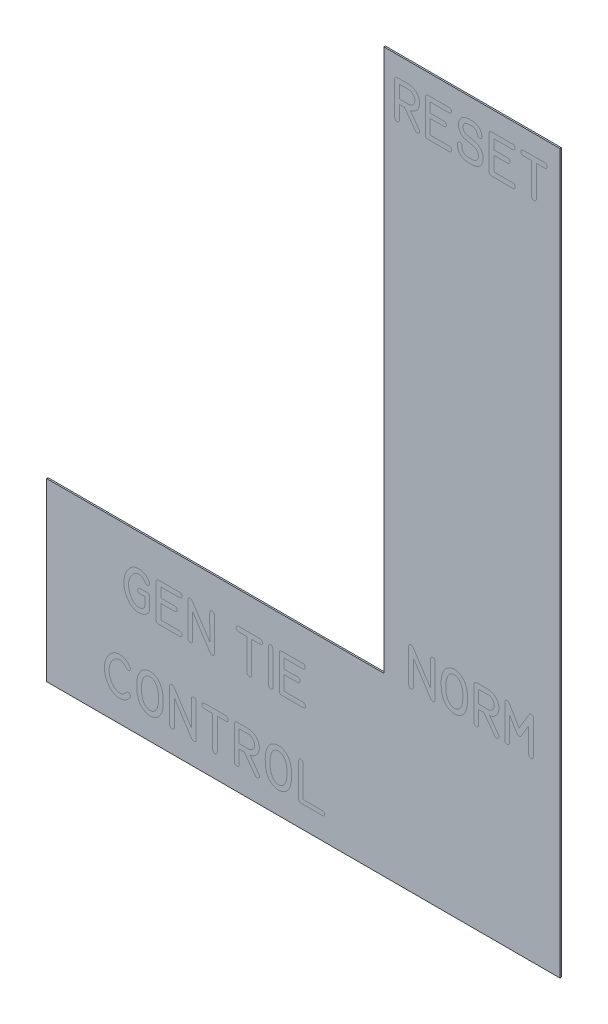
from build123d import *

# Parameters (mm, degrees)
BOSS_EXTRUDE1_DEPTH = 0.127


with BuildPart() as part:
    # Sketch1 → Boss-Extrude1 (new body)
    with BuildSketch(Plane.XY):
        Polygon((0, 50.8), (0, 113.03), (-15.24, 113.03), (-15.24, 66.04), (-44.45, 66.04), (-44.45, 50.8), align=None)
    extrude(amount=BOSS_EXTRUDE1_DEPTH)


solid = part.part
